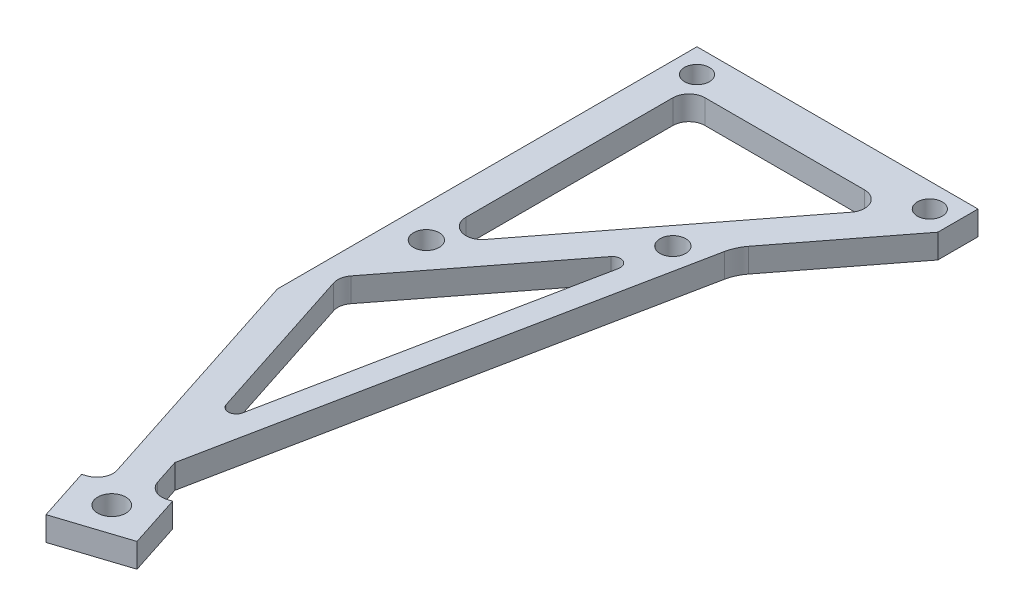
from build123d import *

# Parameters (mm, degrees)
EXTRUDE_1_DEPTH      = 4
EXTRUDE_1_DEPTH_BACK = 3
SKETCH_1_W           = 100
SKETCH_1_H           = 14
SKETCH_1_R           = 1.75
SKETCH_2_W           = 88
SKETCH_2_H           = 14
EXTRUDE_2_DEPTH      = 3
SKETCH_10_W          = 88
SKETCH_10_H          = 4
EXTRUDE_5_DEPTH      = 35
SKETCH_11_R          = 1.6
CUT_EXTRUDE_3_DEPTH  = 25
SKETCH_19_W          = 65
SKETCH_19_H          = 14
CUT_EXTRUDE_7_DEPTH  = 10
SKETCH_21_R          = 1.75
CUT_EXTRUDE_9_DEPTH  = 25
FILLET_3_R           = 2
FILLET_4_R           = 1
FILLET_5_R           = 5
CUT_EXTRUDE_14_REACH = 106.771
SKETCH_27_W          = 35
SKETCH_27_H          = 3
SKETCH_28_W          = 56.249176637
SKETCH_28_H          = 109.102130605
CUT_EXTRUDE_15_DEPTH = 10
CUT_EXTRUDE_16_DEPTH = 1
SKETCH_34_R          = 1.55
CUT_EXTRUDE_17_DEPTH = 104.874924789
SKETCH_35_R          = 1.6
CUT_EXTRUDE_18_DEPTH = 10


with BuildPart() as part:
    # 草图1 → 凸台-拉伸1 (new, two sides: drawn at the far end of the back side and taken through both)
    # profile 1 of 3: a face of its own
    with BuildSketch(Plane.XY.offset(-EXTRUDE_1_DEPTH_BACK)):
        Rectangle(SKETCH_1_W, SKETCH_1_H)
        with Locations((26.315, 2.5)):
            Circle(SKETCH_1_R, mode=Mode.SUBTRACT)
        with Locations((26.315, -2.5)):
            Circle(SKETCH_1_R, mode=Mode.SUBTRACT)
        with Locations((-26.315, -2.5)):
            Circle(SKETCH_1_R, mode=Mode.SUBTRACT)
        with Locations((-26.315, 2.5)):
            Circle(SKETCH_1_R, mode=Mode.SUBTRACT)
    # profile 2 of 3: a face of its own
    with BuildSketch(Plane.XY.offset(-EXTRUDE_1_DEPTH_BACK)):
        with Locations((-26.315, -2.5)):
            Circle(SKETCH_1_R)
    # profile 3 of 3: a face of its own
    with BuildSketch(Plane.XY.offset(-EXTRUDE_1_DEPTH_BACK)):
        with Locations((26.315, -2.5)):
            Circle(SKETCH_1_R)
    extrude(amount=EXTRUDE_1_DEPTH + EXTRUDE_1_DEPTH_BACK)

    # 草图2 → 凸台-拉伸2 (add)
    with BuildSketch(Plane(origin=(15, 0, 0), x_dir=(0, 0, -1), z_dir=(1, 0, 0))):
        with Locations((-47, 0)):
            Rectangle(SKETCH_2_W, SKETCH_2_H)
    extrude(amount=EXTRUDE_2_DEPTH)

    # 草图10 → 凸台-拉伸5 (add)
    with BuildSketch(Plane(origin=(18, 0, 0), x_dir=(0, 0, -1), z_dir=(1, 0, 0))):
        with Locations((-47, -5)):
            Rectangle(SKETCH_10_W, SKETCH_10_H)
        with Locations((-47, 5)):
            Rectangle(SKETCH_10_W, SKETCH_10_H)
    extrude(amount=EXTRUDE_5_DEPTH)

    # 草图11 → 切除-拉伸3 (cut, symmetric)
    with BuildSketch(Plane(origin=(0, 0, 0), x_dir=(1, 0, 0), z_dir=(0, 1, 0))):
        Polygon((39.023998465, -19.228520587), (27.337663153, -77.353689014), (28.983307446, -82.429042884), (31.361421746, -81.657957689), (33.490440504, -88.2240933), (24.929229025, -91), (53, -91), (53, 0), (50, 0), (50, -5), align=None)
        Polygon((15, -91), (24.929229025, -91), (22.800210266, -84.433864389), (25.178324566, -83.662779195), (15, -52.271670437), align=None)
        Polygon((34.885276375, -24.593670389), (17.526825547, -47.095951771), (25.448841284, -71.528347887), align=None)
        with BuildLine():
            Line((19, -5), (19, -32.770283869))
            ThreePointArc((19, -32.770283869), (20.354693788, -34.663318442), (22.583579893, -33.991870838))
            Line((22.583579893, -33.991870838), (44.948155104, -5))
            Line((44.948155104, -5), (19, -5))
        make_face()
        with Locations((19, -37.702345436)):
            Circle(SKETCH_11_R)
    extrude(amount=CUT_EXTRUDE_3_DEPTH, both=True, mode=Mode.SUBTRACT)

    # 草图19 → 切除-拉伸7 (cut)
    with BuildSketch(Plane.XY.offset(4)):
        with Locations((-17.5, 0)):
            Rectangle(SKETCH_19_W, SKETCH_19_H)
    extrude(amount=-CUT_EXTRUDE_7_DEPTH, mode=Mode.SUBTRACT)

    # 草图21 → 切除-拉伸9 (cut, symmetric)
    with BuildSketch(Plane(origin=(0, 0, 0.28540368), x_dir=(1, 0, 0), z_dir=(0, -1, 0))):
        with Locations((28, 85.595375174)):
            Circle(SKETCH_21_R)
    extrude(amount=CUT_EXTRUDE_9_DEPTH, both=True, mode=Mode.SUBTRACT)

    # 圆角3
    # the kernel refuses this fillet: 2 mm, written as the material it adds along each edge
    with BuildSketch(Plane(origin=(25.178324566, 7, 83.662779195), x_dir=(-0.3084340777609257, 0, -0.9512457199250713), z_dir=(0, -1, 0)), Plane(origin=(25.178324566, -3, 83.662779195), x_dir=(-0.3084340777609257, 0, -0.9512457199250713), z_dir=(0, -1, 0)), Plane(origin=(19, 7, 5), x_dir=(0, 0, 1), z_dir=(0, -1, 0)), Plane(origin=(19, -3, 5), x_dir=(0, 0, 1), z_dir=(0, -1, 0)), Plane(origin=(28.983307446, 3, 82.429042884), x_dir=(-0.30843407776092724, 0, -0.9512457199250708), z_dir=(0, 1, 0)), Plane(origin=(28.983307446, -7, 82.429042884), x_dir=(-0.30843407776092724, 0, -0.9512457199250708), z_dir=(0, 1, 0))) as fillet_3_piece_1:
        with BuildLine():
            CenterArc((FILLET_3_R, -FILLET_3_R), FILLET_3_R, 90, 90)
            Line((0, -FILLET_3_R), (0, 0))
            Line((0, 0), (FILLET_3_R, 0))
        make_face()
    extrude(amount=4)
    with BuildSketch(Plane(origin=(17.526825547, -7, 47.095951771), x_dir=(0.6107934844398675, 0, -0.7917899464920006), z_dir=(0, 1, 0))) as fillet_3_piece_2_section:
        with BuildLine():
            CenterArc((FILLET_3_R * 0.527371630949, -FILLET_3_R), FILLET_3_R, 90, 55.611785257)
            Line((-FILLET_3_R * 0.297858058809, -FILLET_3_R * 0.435202727395), (0, 0))
            Line((0, 0), (FILLET_3_R * 0.527371630949, 0))
        make_face()
    fillet_3_piece_2 = extrude(amount=14, mode=Mode.PRIVATE)
    fillet_3_piece_2 = split(fillet_3_piece_2, bisect_by=Plane(origin=(18.071498968, -3, 46.365808537), z_dir=(0, -1, 0)), keep=Keep.TOP, mode=Mode.PRIVATE)
    fillet_3_piece_2 = split(fillet_3_piece_2, bisect_by=Plane(origin=(18, -5, 46.365808537), z_dir=(1, 0, 0)), keep=Keep.TOP, mode=Mode.PRIVATE)
    add(fillet_3_piece_2)
    with BuildSketch(Plane(origin=(17.526825547, -7, 47.095951771), x_dir=(0.6107934844398675, 0, -0.7917899464920006), z_dir=(0, 1, 0))) as fillet_3_piece_3_section:
        with BuildLine():
            CenterArc((FILLET_3_R * 0.527371630949, -FILLET_3_R), FILLET_3_R, 90, 55.611785257)
            Line((-FILLET_3_R * 0.297858058809, -FILLET_3_R * 0.435202727395), (0, 0))
            Line((0, 0), (FILLET_3_R * 0.527371630949, 0))
        make_face()
    fillet_3_piece_3 = extrude(amount=14, mode=Mode.PRIVATE)
    fillet_3_piece_3 = split(fillet_3_piece_3, bisect_by=Plane(origin=(17.718589795, -3, 47.171312239), z_dir=(0, -1, 0)), keep=Keep.TOP, mode=Mode.PRIVATE)
    fillet_3_piece_3 = split(fillet_3_piece_3, bisect_by=Plane(origin=(18, -5, 47.171312239), z_dir=(-1, 0, 0)), keep=Keep.TOP, mode=Mode.PRIVATE)
    add(fillet_3_piece_3)
    with BuildSketch(Plane(origin=(17.526825547, -7, 47.095951771), x_dir=(0.6107934844398675, 0, -0.7917899464920006), z_dir=(0, 1, 0))) as fillet_3_piece_4_section:
        with BuildLine():
            CenterArc((FILLET_3_R * 0.527371630949, -FILLET_3_R), FILLET_3_R, 90, 55.611785257)
            Line((-FILLET_3_R * 0.297858058809, -FILLET_3_R * 0.435202727395), (0, 0))
            Line((0, 0), (FILLET_3_R * 0.527371630949, 0))
        make_face()
    fillet_3_piece_4 = extrude(amount=14, mode=Mode.PRIVATE)
    fillet_3_piece_4 = split(fillet_3_piece_4, bisect_by=Plane(origin=(17.718589795, -3, 47.171312239), z_dir=(0, 1, 0)), keep=Keep.TOP, mode=Mode.PRIVATE)
    fillet_3_piece_4 = split(fillet_3_piece_4, bisect_by=Plane(origin=(18, 0, 47.171312239), z_dir=(-1, 0, 0)), keep=Keep.TOP, mode=Mode.PRIVATE)
    fillet_3_piece_4 = split(fillet_3_piece_4, bisect_by=Plane(origin=(17.718589795, 3, 47.171312239), z_dir=(0, -1, 0)), keep=Keep.TOP, mode=Mode.PRIVATE)
    add(fillet_3_piece_4)
    with BuildSketch(Plane(origin=(17.526825547, -7, 47.095951771), x_dir=(0.6107934844398675, 0, -0.7917899464920006), z_dir=(0, 1, 0))) as fillet_3_piece_5_section:
        with BuildLine():
            CenterArc((FILLET_3_R * 0.527371630949, -FILLET_3_R), FILLET_3_R, 90, 55.611785257)
            Line((-FILLET_3_R * 0.297858058809, -FILLET_3_R * 0.435202727395), (0, 0))
            Line((0, 0), (FILLET_3_R * 0.527371630949, 0))
        make_face()
    fillet_3_piece_5 = extrude(amount=14, mode=Mode.PRIVATE)
    fillet_3_piece_5 = split(fillet_3_piece_5, bisect_by=Plane(origin=(18, 5, 46.365808537), z_dir=(1, 0, 0)), keep=Keep.TOP, mode=Mode.PRIVATE)
    fillet_3_piece_5 = split(fillet_3_piece_5, bisect_by=Plane(origin=(18.071498968, 3, 46.365808537), z_dir=(0, 1, 0)), keep=Keep.TOP, mode=Mode.PRIVATE)
    add(fillet_3_piece_5)
    with BuildSketch(Plane(origin=(17.526825547, -7, 47.095951771), x_dir=(0.6107934844398675, 0, -0.7917899464920006), z_dir=(0, 1, 0))) as fillet_3_piece_6_section:
        with BuildLine():
            CenterArc((FILLET_3_R * 0.527371630949, -FILLET_3_R), FILLET_3_R, 90, 55.611785257)
            Line((-FILLET_3_R * 0.297858058809, -FILLET_3_R * 0.435202727395), (0, 0))
            Line((0, 0), (FILLET_3_R * 0.527371630949, 0))
        make_face()
    fillet_3_piece_6 = extrude(amount=14, mode=Mode.PRIVATE)
    fillet_3_piece_6 = split(fillet_3_piece_6, bisect_by=Plane(origin=(18, 5, 47.171312239), z_dir=(-1, 0, 0)), keep=Keep.TOP, mode=Mode.PRIVATE)
    fillet_3_piece_6 = split(fillet_3_piece_6, bisect_by=Plane(origin=(17.718589795, 3, 47.171312239), z_dir=(0, 1, 0)), keep=Keep.TOP, mode=Mode.PRIVATE)
    add(fillet_3_piece_6)
    with BuildSketch(Plane(origin=(44.948155104, 7.171848554, 5), x_dir=(-1, 0, 0), z_dir=(0, -1, 0))) as fillet_3_piece_7_section:
        with BuildLine():
            CenterArc((FILLET_3_R * 2.03436971078, -FILLET_3_R), FILLET_3_R, 90, 127.646899195)
            Line((FILLET_3_R * 1.24257976428, -FILLET_3_R * 1.61079348444), (0, 0))
            Line((0, 0), (FILLET_3_R * 2.03436971078, 0))
        make_face()
    fillet_3_piece_7 = extrude(amount=14.171848554, mode=Mode.PRIVATE)
    fillet_3_piece_7 = split(fillet_3_piece_7, bisect_by=Plane(origin=(43.295874914, 7, 5.81218285), z_dir=(0, -1, 0)), keep=Keep.TOP, mode=Mode.PRIVATE)
    fillet_3_piece_7 = split(fillet_3_piece_7, bisect_by=Plane(origin=(43.295874914, 3, 5.81218285), z_dir=(0, 1, 0)), keep=Keep.TOP, mode=Mode.PRIVATE)
    add(fillet_3_piece_7)
    with BuildSketch(Plane(origin=(44.948155104, -3, 5), x_dir=(-1, 0, 0), z_dir=(0, -1, 0)), Plane(origin=(44.948155104, 7, 5), x_dir=(-1, 0, 0), z_dir=(0, -1, 0))) as fillet_3_piece_8:
        with BuildLine():
            CenterArc((FILLET_3_R * 2.03436971078, -FILLET_3_R), FILLET_3_R, 90, 127.646899195)
            Line((FILLET_3_R * 1.24257976428, -FILLET_3_R * 1.61079348444), (0, 0))
            Line((0, 0), (FILLET_3_R * 2.03436971078, 0))
        make_face()
    extrude(amount=4)
    with BuildSketch(Plane(origin=(44.948155104, 7, 5), x_dir=(-1, 0, 0), z_dir=(0, -1, 0))) as fillet_3_piece_9_section:
        with BuildLine():
            CenterArc((FILLET_3_R * 2.03436971078, -FILLET_3_R), FILLET_3_R, 90, 127.646899195)
            Line((FILLET_3_R * 1.24257976428, -FILLET_3_R * 1.61079348444), (0, 0))
            Line((0, 0), (FILLET_3_R * 2.03436971078, 0))
        make_face()
    fillet_3_piece_9 = extrude(amount=14.171848554, mode=Mode.PRIVATE)
    fillet_3_piece_9 = split(fillet_3_piece_9, bisect_by=Plane(origin=(43.295874914, -7, 5.81218285), z_dir=(0, 1, 0)), keep=Keep.TOP, mode=Mode.PRIVATE)
    fillet_3_piece_9 = split(fillet_3_piece_9, bisect_by=Plane(origin=(43.295874914, -3, 5.81218285), z_dir=(0, -1, 0)), keep=Keep.TOP, mode=Mode.PRIVATE)
    add(fillet_3_piece_9)

    # 圆角4
    fillet_4_edges = [part.edges().sort_by_distance(p)[0] for p in [
        (34.885276375, 5, 24.593670389),
        (34.885276375, -5, 24.593670389),
        (25.448841284, -5, 71.528347887),
        (25.448841284, 5, 71.528347887),
    ]]
    fillet(fillet_4_edges, radius=FILLET_4_R)

    # 圆角5
    fillet_5_edges = [part.edges().sort_by_distance(p)[0] for p in [
        (39.023998465, 5, 19.228520587),
        (39.023998465, -5, 19.228520587),
    ]]
    fillet(fillet_5_edges, radius=FILLET_5_R)

    # 草图27 → 切除-拉伸14 (cut, up to next)
    with BuildSketch(Plane(origin=(0, 7, 0), x_dir=(1, 0, 0), z_dir=(0, 1, 0)), mode=Mode.PRIVATE) as cut_extrude_14_sk1:
        with Locations((32.5, 1.5)):
            Rectangle(SKETCH_27_W, SKETCH_27_H)
    cut_extrude_14_tool1 = extrude(cut_extrude_14_sk1.sketch, amount=-CUT_EXTRUDE_14_REACH, mode=Mode.PRIVATE) & part.part
    add(cut_extrude_14_tool1.solids().sort_by_distance((32.5, 7, -1.5))[0], mode=Mode.SUBTRACT)

    # 草图28 → 切除-拉伸15 (cut)
    with BuildSketch(Plane(origin=(0, 7, 0), x_dir=(1, 0, 0), z_dir=(0, 1, 0))):
        with Locations((28.124588319, -46.75205982)):
            Rectangle(SKETCH_28_W, SKETCH_28_H)
    extrude(amount=-CUT_EXTRUDE_15_DEPTH, mode=Mode.SUBTRACT)

    # 草图33 → 切除-拉伸16 (cut)
    with BuildSketch(Plane.XZ.offset(7)):
        with BuildLine():
            Line((15, 52.271670437), (15, 0))
            Line((15, 0), (50, 0))
            Line((50, 0), (50, 5))
            Line((50, 5), (39.736895245, 18.304371071))
            ThreePointArc((39.736895245, 18.304371071), (39.146308678, 19.2842798), (38.793938309, 20.372787371))
            Line((38.793938309, 20.372787371), (27.337663153, 77.353689014))
            Line((27.337663153, 77.353689014), (28.36643929, 80.526551444))
            ThreePointArc((28.36643929, 80.526551444), (29.359857788, 81.691139542), (30.885798886, 81.812174728))
            Line((30.885798886, 81.812174728), (31.361421746, 81.657957689))
            Line((31.361421746, 81.657957689), (33.490440504, 88.2240933))
            Line((33.490440504, 88.2240933), (24.929229025, 91))
            Line((24.929229025, 91), (22.800210266, 84.433864389))
            Line((22.800210266, 84.433864389), (23.275833126, 84.27964735))
            ThreePointArc((23.275833126, 84.27964735), (24.440421225, 83.286228853), (24.561456411, 81.760287755))
            Line((24.561456411, 81.760287755), (15, 52.271670437))
        make_face()
    extrude(amount=-CUT_EXTRUDE_16_DEPTH, mode=Mode.SUBTRACT)

    # 草图34 → 切除-拉伸17 (cut, through all)
    with BuildSketch(Plane(origin=(0, -3, 0), x_dir=(1, 0, 0), z_dir=(0, 1, 0))):
        with Locations(Location((18, -3, 0), (0, 0, 270))):
            Circle(SKETCH_34_R)
        with Locations(Location((47, -3, 0), (0, 0, 270))):
            Circle(SKETCH_34_R)
    extrude(amount=-CUT_EXTRUDE_17_DEPTH, mode=Mode.SUBTRACT)

    # 草图35 → 切除-拉伸18 (cut)
    with BuildSketch(Plane(origin=(0, -3, 0), x_dir=(1, 0, 0), z_dir=(0, 1, 0))):
        with Locations(Location((35, -23, 0), (0, 0, 270))):
            Circle(SKETCH_35_R)
    extrude(amount=-CUT_EXTRUDE_18_DEPTH, mode=Mode.SUBTRACT)


solid = part.part
